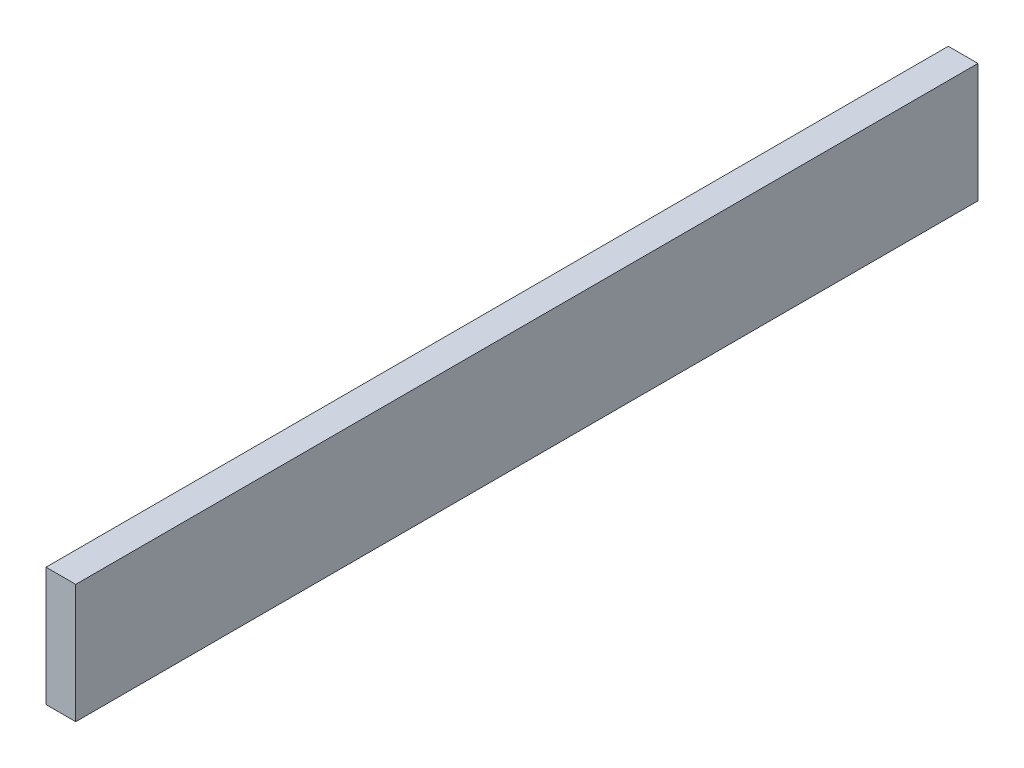
from build123d import *

# Parameters (mm, degrees)
SKETCH1_W           = 76.2
SKETCH1_H           = 2311.4
BOSS_EXTRUDE1_DEPTH = 304.8


with BuildPart() as part:
    # Sketch1 → Boss-Extrude1 (new body)
    with BuildSketch(Plane(origin=(0, 0, 0), x_dir=(1, 0, 0), z_dir=(0, 1, 0))):
        with Locations((38.1, 1155.7)):
            Rectangle(SKETCH1_W, SKETCH1_H)
    extrude(amount=BOSS_EXTRUDE1_DEPTH)


solid = part.part
